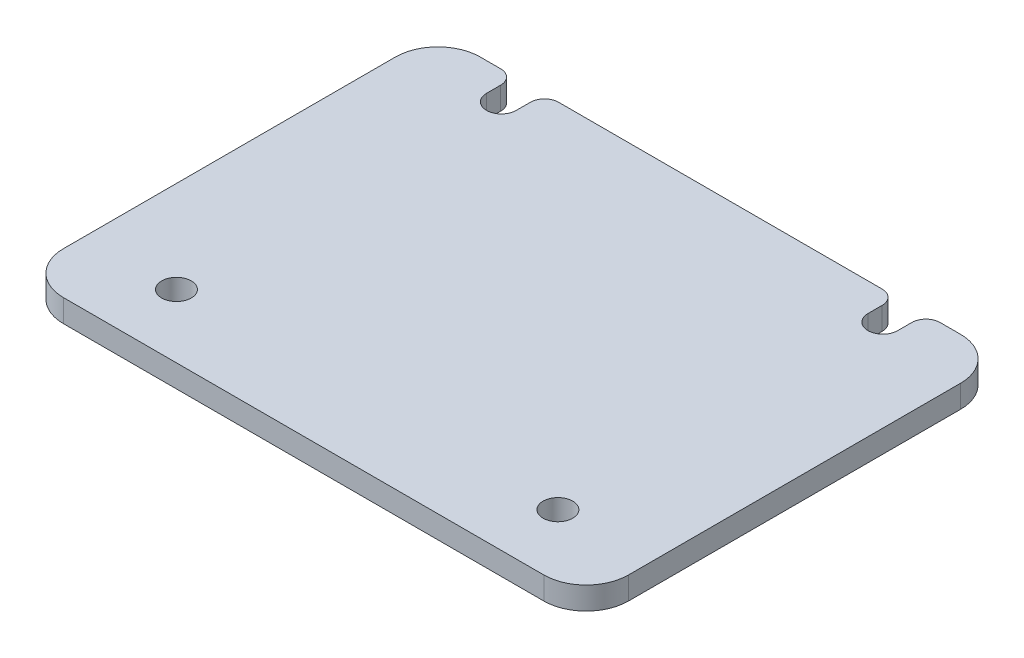
from build123d import *

# Parameters (mm, degrees)
SKETCH1_W                = 40
SKETCH1_H                = 29.5
BOSS_EXTRUDE1_DEPTH      = 1.6
FILLET1_R                = 3
M2_CLEARANCE_HOLE3_D     = 2.1
M2_CLEARANCE_HOLE3_DEPTH = 5.2
M2_CLEARANCE_HOLE3_TIP   = 0.63090365
CUT_EXTRUDE2_DEPTH       = 25.902258934
CUT_EXTRUDE2_DEPTH_BACK  = 25.902258934
FILLET3_R                = 1
SKETCH11_W               = 30
SKETCH11_H               = 28.944863729
SKETCH11_R               = 0.8
CUT_EXTRUDE3_DEPTH       = 0.001


with BuildPart() as part:
    # Sketch1 → Boss-Extrude1 (new body)
    with BuildSketch(Plane(origin=(0, 0, 0), x_dir=(1, 0, 0), z_dir=(0, 1, 0))):
        Rectangle(SKETCH1_W, SKETCH1_H)
    extrude(amount=BOSS_EXTRUDE1_DEPTH)

    # Fillet1
    fillet1_edges = [part.edges().sort_by_distance(p)[0] for p in [
        (20, 0.8, -14.75),
        (20, 0.8, 14.75),
        (-20, 0.8, 14.75),
        (-20, 0.8, -14.75),
    ]]
    fillet(fillet1_edges, radius=FILLET1_R)

    # M2 Clearance Hole3
    with Locations(Plane(origin=(0, 1.6, 0), x_dir=(1, 0, 0), z_dir=(0, 1, 0))):
        with Locations((-13.5, 12.75), (13.5, 12.75), (13.5, -10.25), (-13.5, -10.25)):
            Hole(M2_CLEARANCE_HOLE3_D / 2, depth=M2_CLEARANCE_HOLE3_DEPTH)
            with Locations((0, 0, -(M2_CLEARANCE_HOLE3_DEPTH + M2_CLEARANCE_HOLE3_TIP / 2))):  # 118° drill point
                Cone(0, M2_CLEARANCE_HOLE3_D / 2, M2_CLEARANCE_HOLE3_TIP, mode=Mode.SUBTRACT)

    # Sketch10 → Cut-Extrude2 (cut, two sides: drawn at the far end of the back side and taken through both)
    with BuildSketch(Plane(origin=(0, 1.6, 0), x_dir=(1, 0, 0), z_dir=(0, 1, 0)).offset(-CUT_EXTRUDE2_DEPTH_BACK)):
        with BuildLine():
            Line((-14.55, 12.75), (-14.55, 17.75))
            ThreePointArc((-14.55, 17.75), (-13.5, 18.8), (-12.45, 17.75))
            Line((-12.45, 17.75), (-12.45, 12.75))
            ThreePointArc((-12.45, 12.75), (-13.5, 11.7), (-14.55, 12.75))
        make_face()
        with BuildLine():
            Line((14.55, 12.75), (14.55, 17.75))
            ThreePointArc((14.55, 17.75), (13.5, 18.8), (12.45, 17.75))
            Line((12.45, 17.75), (12.45, 12.75))
            ThreePointArc((12.45, 12.75), (13.5, 11.7), (14.55, 12.75))
        make_face()
    extrude(amount=CUT_EXTRUDE2_DEPTH + CUT_EXTRUDE2_DEPTH_BACK, mode=Mode.SUBTRACT)

    # Fillet3
    fillet3_edges = [part.edges().sort_by_distance(p)[0] for p in [
        (-12.45, 0.8, -14.75),
        (14.55, 0.8, -14.75),
        (12.45, 0.8, -14.75),
        (-14.55, 0.8, -14.75),
    ]]
    fillet(fillet3_edges, radius=FILLET3_R)

    # Sketch11 → Cut-Extrude3 (cut)
    with BuildSketch(Plane.XZ):
        with Locations((0, -0.277568136)):
            Rectangle(SKETCH11_W, SKETCH11_H)
        with Locations((13.5, -12.75)):
            Circle(SKETCH11_R, mode=Mode.SUBTRACT)
        with Locations((13.5, 10.25)):
            Circle(SKETCH11_R, mode=Mode.SUBTRACT)
        with Locations((-13.5, -12.75)):
            Circle(SKETCH11_R, mode=Mode.SUBTRACT)
        with Locations((-13.5, 10.25)):
            Circle(SKETCH11_R, mode=Mode.SUBTRACT)
        with BuildLine():
            Line((-10, 11.694863729), (10, 11.694863729))
            add(Edge.make_bspline(
                [(12, 9.694064457), (12, 11.694863729), (10, 11.694863729)],
                knots=[4.71238898, 4.71238898, 4.71238898, 6.283185307, 6.283185307, 6.283185307], degree=2, weights=[1, 0.707106781, 1]))
            Line((12, 9.694064457), (12, -9.74800182))
            add(Edge.make_bspline(
                [(10, -11.748801092), (12, -11.748801092), (12, -9.74800182)],
                knots=[3.141592654, 3.141592654, 3.141592654, 4.71238898, 4.71238898, 4.71238898], degree=2, weights=[1, 0.707106781, 1]))
            Line((10, -11.748801092), (-10, -11.748801092))
            add(Edge.make_bspline(
                [(-12, -9.74800182), (-12, -11.748801092), (-10, -11.748801092)],
                knots=[1.570796327, 1.570796327, 1.570796327, 3.141592654, 3.141592654, 3.141592654], degree=2, weights=[1, 0.707106781, 1]))
            Line((-12, -9.74800182), (-12, 9.694064457))
            add(Edge.make_bspline(
                [(-10, 11.694863729), (-12, 11.694863729), (-12, 9.694064457)],
                knots=[0, 0, 0, 1.570796327, 1.570796327, 1.570796327], degree=2, weights=[1, 0.707106781, 1]))
        make_face(mode=Mode.SUBTRACT)
    extrude(amount=-CUT_EXTRUDE3_DEPTH, mode=Mode.SUBTRACT)


solid = part.part
